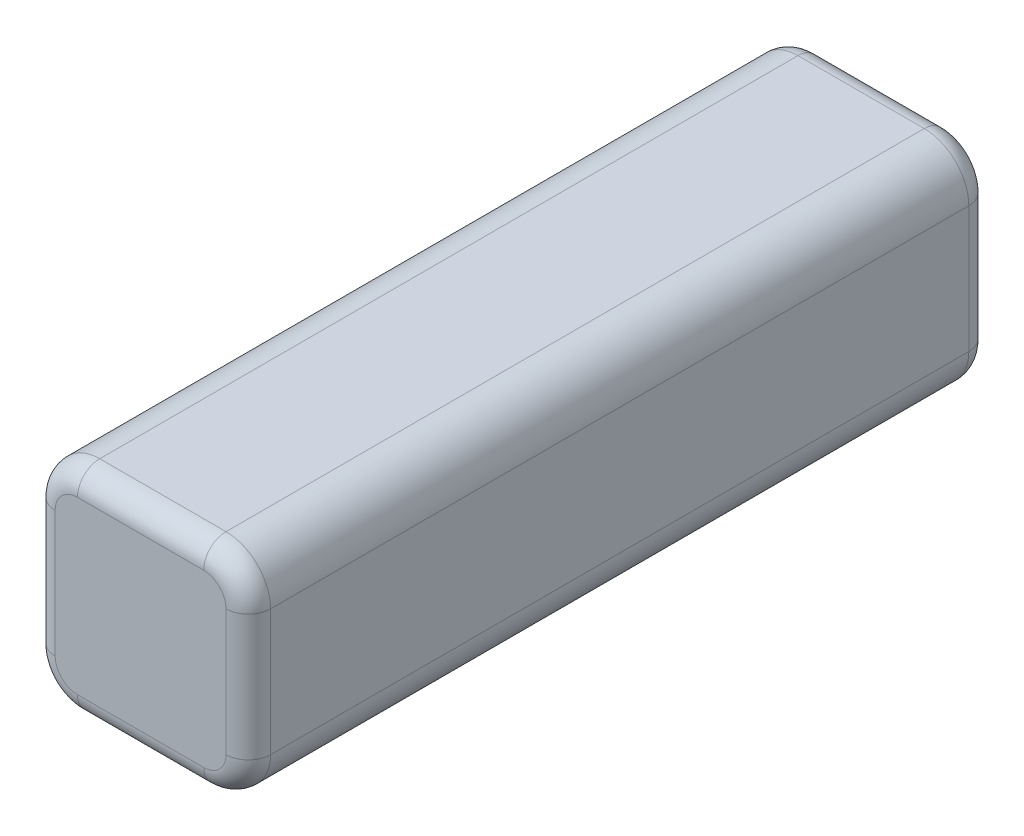
from build123d import *

# Parameters (mm, degrees)
RESSALTO_EXTRUS_O1_DEPTH = 10
FILETE1_R                = 0.3


with BuildPart() as part:
    # Esboço1 → Ressalto-extrusão1 (new body)
    with BuildSketch(Plane.XY):
        with BuildLine():
            Line((-1.45, -0.85), (-1.45, 0.85))
            ThreePointArc((-1.45, 0.85), (-1.274264069, 1.274264069), (-0.85, 1.45))
            Line((-0.85, 1.45), (0.85, 1.45))
            ThreePointArc((0.85, 1.45), (1.274264069, 1.274264069), (1.45, 0.85))
            Line((1.45, 0.85), (1.45, -0.85))
            ThreePointArc((1.45, -0.85), (1.274264069, -1.274264069), (0.85, -1.45))
            Line((0.85, -1.45), (-0.85, -1.45))
            ThreePointArc((-0.85, -1.45), (-1.274264069, -1.274264069), (-1.45, -0.85))
        make_face()
    extrude(amount=RESSALTO_EXTRUS_O1_DEPTH)

    # Filete1
    filete1_edges = [part.edges().sort_by_distance(p)[0] for p in [
        (0, 1.45, 0),
        (0, 1.45, 10),
        (0, -1.45, 0),
        (1.274264069, -1.274264069, 0),
        (1.45, 0, 0),
        (1.274264069, 1.274264069, 0),
        (-1.274264069, 1.274264069, 0),
        (-1.45, 0, 0),
        (-1.274264069, -1.274264069, 0),
        (-1.45, 0, 10),
        (-1.274264069, 1.274264069, 10),
        (1.274264069, 1.274264069, 10),
        (1.45, 0, 10),
        (1.274264069, -1.274264069, 10),
        (0, -1.45, 10),
        (-1.274264069, -1.274264069, 10),
    ]]
    fillet(filete1_edges, radius=FILETE1_R)


solid = part.part
